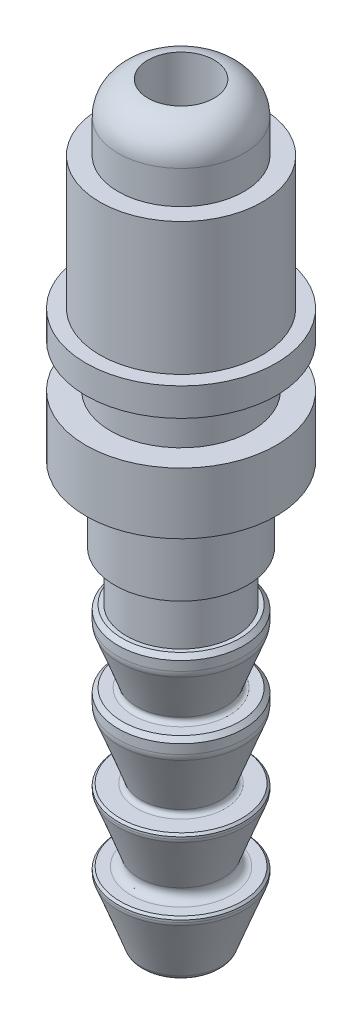
from build123d import *

# Parameters (mm, degrees)
SKETCH1_R           = 5.75
BOSS_EXTRUDE1_DEPTH = 16
SKETCH2_OUTSIDE_W   = 18.062
SKETCH2_OUTSIDE_H   = 18.062
SKETCH2_OUTSIDE_R   = 4.9
CUT_EXTRUDE1_DEPTH  = 8
SKETCH3_R           = 3.8
BOSS_EXTRUDE2_DEPTH = 4
FILLET2_R           = 2
SKETCH4_R           = 4
BOSS_EXTRUDE3_DEPTH = 4.5
SKETCH5_R           = 3.3
BOSS_EXTRUDE4_DEPTH = 3
BOSS_EXTRUDE5_START = 1
SKETCH6_R           = 3.8
BOSS_EXTRUDE5_DEPTH = 1
BOSS_EXTRUDE6_REACH = 35.502
SKETCH10_R          = 3.8
LPATTERN1_COUNT     = 4
LPATTERN1_PITCH     = 4.35
CHAMFER1_SIZE       = 0.25
CHAMFER2_SIZE       = 0.25
CHAMFER3_SIZE       = 0.125
CHAMFER4_SIZE       = 0.125
FILLET3_R           = 0.5
FILLET4_R           = 1
FILLET5_R           = 0.25
FILLET6_R           = 0.5
FILLET7_R           = 0.5
SKETCH12_W          = 1.5
SKETCH12_H          = 2.6
SKETCH13_R          = 2
CUT_EXTRUDE2_DEPTH  = 47.270157769


with BuildPart() as part:
    # Sketch1 → Boss-Extrude1 (new body)
    with BuildSketch(Plane(origin=(0, 0, 0), x_dir=(1, 0, 0), z_dir=(0, 1, 0))):
        Circle(SKETCH1_R)
    extrude(amount=BOSS_EXTRUDE1_DEPTH)

    # Sketch2 outside → Cut-Extrude1 (cut)
    with BuildSketch(Plane(origin=(0, 16, 0), x_dir=(1, 0, 0), z_dir=(0, 1, 0))):
        Rectangle(SKETCH2_OUTSIDE_W, SKETCH2_OUTSIDE_H)
        Circle(SKETCH2_OUTSIDE_R, mode=Mode.SUBTRACT)
    extrude(amount=-CUT_EXTRUDE1_DEPTH, mode=Mode.SUBTRACT)

    # Sketch3 → Boss-Extrude2 (add)
    with BuildSketch(Plane(origin=(0, 16, 0), x_dir=(1, 0, 0), z_dir=(0, 1, 0))):
        Circle(SKETCH3_R)
    extrude(amount=BOSS_EXTRUDE2_DEPTH)

    # Fillet2
    fillet2_edges = [part.edges().sort_by_distance(p)[0] for p in [
        (-3.8, 20, 0),
    ]]
    fillet(fillet2_edges, radius=FILLET2_R)

    # Sketch4 → Boss-Extrude3 (add)
    with BuildSketch(Plane.XZ):
        Circle(SKETCH4_R)
    extrude(amount=BOSS_EXTRUDE3_DEPTH)

    # Sketch5 → Boss-Extrude4 (add)
    with BuildSketch(Plane.XZ.offset(4.5)):
        Circle(SKETCH5_R)
    extrude(amount=BOSS_EXTRUDE4_DEPTH)

    # Sketch6 → Boss-Extrude5 (add)
    with BuildSketch(Plane.XZ.offset(7.5).offset(BOSS_EXTRUDE5_START)):
        Circle(SKETCH6_R)
    boss_extrude5 = extrude(amount=-BOSS_EXTRUDE5_DEPTH)

    # Sketch10 → Boss-Extrude6 (add, up to next)
    with BuildSketch(Plane(origin=(0, -12.5, 0), x_dir=(-1, 0, 0), z_dir=(0, -1, 0)), mode=Mode.PRIVATE) as boss_extrude6_sk1:
        Circle(SKETCH10_R)
    boss_extrude6_tool1 = extrude(boss_extrude6_sk1.sketch, amount=-BOSS_EXTRUDE6_REACH, mode=Mode.PRIVATE) - part.part
    boss_extrude6 = boss_extrude6_tool1.solids().sort_by_distance((0, -12.5, 0))[0]
    add(boss_extrude6)

    # Sketch11 → Cut-Revolve1 (revolve, cut)
    with BuildSketch(Plane.XY):
        Polygon((-2.3, -12.5), (-3.8, -8.5), (-3.8, -12.5), align=None)
    cut_revolve1 = revolve(axis=Axis((0, 8, 0), (0, -1, 0)), mode=Mode.SUBTRACT)

    # LPattern1: Boss-Extrude5, Boss-Extrude6, Cut-Revolve1 ×4
    with Locations(*[(0, -i * LPATTERN1_PITCH, 0) for i in range(1, LPATTERN1_COUNT)]):
        add(boss_extrude5)
        add(boss_extrude6)
        add(cut_revolve1, mode=Mode.SUBTRACT)

    # Chamfer1
    chamfer1_edges = [part.edges().sort_by_distance(p)[0] for p in [
        (-3.8, -7.5, 0),
    ]]
    chamfer(chamfer1_edges, length=CHAMFER1_SIZE)

    # Chamfer2
    chamfer2_edges = [part.edges().sort_by_distance(p)[0] for p in [
        (-3.8, -11.85, 0),
    ]]
    chamfer(chamfer2_edges, length=CHAMFER2_SIZE)

    # Chamfer3
    chamfer3_edges = [part.edges().sort_by_distance(p)[0] for p in [
        (-3.8, -16.85, 0),
    ]]
    chamfer(chamfer3_edges, length=CHAMFER3_SIZE)

    # Chamfer4
    chamfer4_edges = [part.edges().sort_by_distance(p)[0] for p in [
        (-3.8, -21.2, 0),
    ]]
    chamfer(chamfer4_edges, length=CHAMFER4_SIZE)

    # Fillet3
    fillet3_edges = [part.edges().sort_by_distance(p)[0] for p in [
        (0, -17.2, 3.8),
        (0, -21.55, 3.8),
    ]]
    fillet(fillet3_edges, radius=FILLET3_R)

    # Fillet4
    fillet4_edges = [part.edges().sort_by_distance(p)[0] for p in [
        (0, -12.85, 3.8),
        (0, -8.5, 3.8),
    ]]
    fillet(fillet4_edges, radius=FILLET4_R)

    # Fillet5
    fillet5_edges = [part.edges().sort_by_distance(p)[0] for p in [
        (2.3, -16.85, 0),
        (2.54375, -11.85, 0),
    ]]
    fillet(fillet5_edges, radius=FILLET5_R)

    # Fillet6
    fillet6_edges = [part.edges().sort_by_distance(p)[0] for p in [
        (2.3, -21.2, 0),
    ]]
    fillet(fillet6_edges, radius=FILLET6_R)

    # Fillet7
    fillet7_edges = [part.edges().sort_by_distance(p)[0] for p in [
        (2.3, -25.55, 0),
    ]]
    fillet(fillet7_edges, radius=FILLET7_R)

    # Sketch12 → Cut-Revolve2 (revolve, cut)
    with BuildSketch(Plane(origin=(0, 0, 0), x_dir=(0, 0, -1), z_dir=(1, 0, 0))):
        with Locations((-5, 5)):
            Rectangle(SKETCH12_W, SKETCH12_H)
    revolve(axis=Axis((0, 8, 0), (0, -1, 0)), mode=Mode.SUBTRACT)

    # Sketch13 → Cut-Extrude2 (cut, through all)
    with BuildSketch(Plane.XZ.offset(25.55)):
        Circle(SKETCH13_R)
    extrude(amount=-CUT_EXTRUDE2_DEPTH, mode=Mode.SUBTRACT)


solid = part.part
